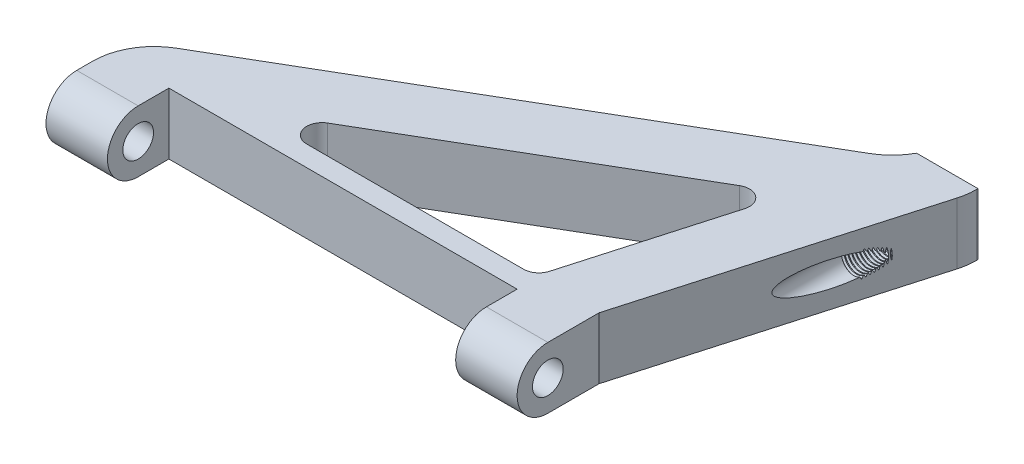
from build123d import *
from build123d.topology import SkipClean

# Parameters (mm, degrees)
BOSS_EXTRUDE1_DEPTH = 19.05
CUT_EXTRUDE1_REACH  = 202.955
SKETCH3_R           = 3.96875
FILLET1_RADIUS      = 9.525
FILLET1_LENGTH      = 19.05
SKETCH6_R           = 4.7625
CUT_EXTRUDE3_DEPTH  = 189.398196979
FILLET2_RADIUS      = 9.525
FILLET2_LENGTH      = 19.05
FILLET3_R           = 19.05
FILLET6_R           = 19.05
THREAD2_PITCH       = 1.058333333


with BuildPart() as part:
    # Sketch1 → Boss-Extrude1 (new body)
    with BuildSketch(Plane(origin=(0, 0, 0), x_dir=(1, 0, 0), z_dir=(0, 1, 0))):
        Polygon((142.875, 0), (161.925, 0), (161.925, -3.175), (136.525, -92.075), (136.525, -117.475), (117.475, -117.475), (117.475, -98.425), (9.525, -98.425), (9.525, -117.475), (-9.525, -117.475), (-9.525, -92.075), (142.875, -3.175), align=None)
        with BuildLine():
            Line((131.143985717, -41.565503295), (117.699598267, -88.620859372))
            ThreePointArc((117.699598267, -88.620859372), (115.988296597, -91.114635437), (113.120340466, -92.075))
            Line((113.120340466, -92.075), (45.898403214, -92.075))
            ThreePointArc((45.898403214, -92.075), (41.300951398, -88.555417151), (43.498717455, -83.198752984))
            Line((43.498717455, -83.198752984), (124.165042157, -36.143396908))
            ThreePointArc((124.165042157, -36.143396908), (129.486618227, -36.496297841), (131.143985717, -41.565503295))
        make_face(mode=Mode.SUBTRACT)
    extrude(amount=BOSS_EXTRUDE1_DEPTH)

    # Cut-Extrude1: up to this plane
    cut_extrude1_end = Plane(origin=(150.542924528, 19.05, 43.012264151), z_dir=(-0.9615239476408233, 0, -0.27472112789737785))
    # Sketch3 → Cut-Extrude1 (cut, up to the surface)
    with BuildSketch(Plane(origin=(0, 0, 0), x_dir=(-1, 0, 0), z_dir=(0, 0, -1)), mode=Mode.PRIVATE) as cut_extrude1_sk1:
        with Locations((-152.4, 9.525)):
            Circle(SKETCH3_R)
    cut_extrude1_tool1 = split(extrude(cut_extrude1_sk1.sketch, amount=-CUT_EXTRUDE1_REACH, mode=Mode.PRIVATE), bisect_by=cut_extrude1_end, keep=Keep.BOTH, mode=Mode.PRIVATE)
    add(cut_extrude1_tool1.solids().sort_by_distance((152.4, 9.525, 0))[0], mode=Mode.SUBTRACT)

    # Fillet1: full round fillet: the end face becomes a half cylinder, R = half its width
    fillet1_face = Plane((0, 9.525, 117.475), x_dir=(-1, 0, 0), z_dir=(0, 0, 1))  # on the end face: x along it, z out of the body
    fillet1_slab = fillet1_face.offset(-FILLET1_RADIUS / 2) * Box(FILLET1_LENGTH, 2 * FILLET1_RADIUS, FILLET1_RADIUS, mode=Mode.PRIVATE)  # the body's end, R deep
    fillet1_round = Plane((0, 9.525, 107.95), x_dir=(0, 0, 1), z_dir=(-1, 0, 0)) * Cylinder(FILLET1_RADIUS, FILLET1_LENGTH, mode=Mode.PRIVATE)  # its axis R under the face
    add(fillet1_slab - fillet1_round, mode=Mode.SUBTRACT)

    # Sketch6 → Cut-Extrude3 (cut, through all)
    with BuildSketch(Plane(origin=(136.525, 0, 0), x_dir=(0, 0, -1), z_dir=(1, 0, 0))):
        with Locations((-107.95, 9.525)):
            Circle(SKETCH6_R)
    extrude(amount=-CUT_EXTRUDE3_DEPTH, mode=Mode.SUBTRACT)

    # Fillet2: full round fillet: the end face becomes a half cylinder, R = half its width
    fillet2_face = Plane((127, 9.525, 117.475), x_dir=(1, 0, 0), z_dir=(0, 0, 1))  # on the end face: x along it, z out of the body
    fillet2_slab = fillet2_face.offset(-FILLET2_RADIUS / 2) * Box(FILLET2_LENGTH, 2 * FILLET2_RADIUS, FILLET2_RADIUS, mode=Mode.PRIVATE)  # the body's end, R deep
    fillet2_round = Plane((127, 9.525, 107.95), x_dir=(0, 0, 1), z_dir=(1, 0, 0)) * Cylinder(FILLET2_RADIUS, FILLET2_LENGTH, mode=Mode.PRIVATE)  # its axis R under the face
    add(fillet2_slab - fillet2_round, mode=Mode.SUBTRACT)

    # Fillet3
    # the kernel refuses this fillet: 19.05 mm, written as the material it adds along each edge
    with BuildSketch(Plane(origin=(142.875, 0, 3.175), x_dir=(-0.8637789008984332, 0, 0.5038710255240864), z_dir=(0, 1, 0))) as fillet3_piece_1:
        with BuildLine():
            CenterArc((8.247436457, -19.05), FILLET3_R, 90, 31.125529059)
            Line((-1.599790506, -2.74249801), (0, 0))
            Line((0, 0), (8.247436457, 0))
        make_face()
    extrude(amount=19.05)
    # the kernel refuses this fillet: 19.05 mm, written as the material it takes off along each edge
    with BuildSketch(Plane(origin=(161.925, -6.670116738, 3.175), x_dir=(0, 0, -1), z_dir=(0, 1, 0))) as fillet3_2_piece_1:
        with BuildLine():
            CenterArc((FILLET3_R * 0.14005494464, FILLET3_R), FILLET3_R, 254.054604099, 15.945395901)
            Line((-FILLET3_R * 0.134666183257, FILLET3_R * 0.0384760523592), (0, 0))
            Line((0, 0), (FILLET3_R * 0.14005494464, 0))
        make_face()
    extrude(amount=32.390233477, mode=Mode.SUBTRACT)

    # Fillet6
    fillet6_edges = [part.edges().sort_by_distance(p)[0] for p in [
        (-9.525, 9.525, 92.075),
    ]]
    fillet(fillet6_edges, radius=FILLET6_R)

    # Thread2: arcs per turn and ends read off the stored shape
    # Thread2: the profile of Thread Profile2 profile screwed along a right-hand helix through 27 turns, 8 arcs to a turn; built about Z, then put on its axis
    with SkipClean():  # the faces are left unmerged after this step: merging them gives an invalid solid
        thread2_z = Axis((0, 0, 0), (0, 0, 1))
        thread2_corners = [(3.96845, 0, -0.000173205), (4.541589718, 0, 0.330729165), (4.541589718, 0, 0.463020832), (3.96845, 0, 0.793923202)]
        with BuildLine(mode=Mode.PRIVATE) as thread2_profile:
            Line(thread2_corners[0], thread2_corners[1])
            Line(thread2_corners[1], thread2_corners[2])
            Line(thread2_corners[2], thread2_corners[3])
            Line(thread2_corners[3], thread2_corners[0])
        thread2_cap = Face(thread2_profile.wire())
        thread2_turn_angles = [0, 22.5, 45, 67.5, 90, 112.5, 135, 157.5, 180, 202.5, 225, 247.5, 270, 292.5, 315, 337.5, 360]
        thread2_turn_weights = [1, 0.9238795325112867, 1, 0.9238795325112867, 1, 0.9238795325112867, 1, 0.9238795325112867, 1, 0.9238795325112867, 1, 0.9238795325112867, 1, 0.9238795325112867, 1, 0.9238795325112867, 1]
        thread2_turn_rails = [Edge.make_bspline([Vector(p[0], p[1], 0).rotate(thread2_z, thread2_turn_angles[k]) / thread2_turn_weights[k] + Vector(0, 0, p[2] + THREAD2_PITCH * thread2_turn_angles[k] / 360) for k in range(17)], [0, 0, 0, 1, 1, 2, 2, 3, 3, 4, 4, 5, 5, 6, 6, 7, 7, 8, 8, 8], 2, thread2_turn_weights) for p in thread2_corners]
        thread2_turn_sides = [Face.make_surface_from_curves(thread2_turn_rails[p[0]], thread2_turn_rails[p[1]]) for p in [(0, 1), (1, 2), (2, 3), (3, 0)]]
        thread2 = Plane(origin=(152.4, 9.525, 0), x_dir=(1, 0, 0), z_dir=(0, 0, 1)) * Solid(Shell([*[p.moved(Location((0, 0, THREAD2_PITCH * i))) for i in range(27) for p in thread2_turn_sides], thread2_cap, thread2_cap.rotate(thread2_z, 9720).moved(Location((0, 0, THREAD2_PITCH * 9720 / 360)))]))
        add(thread2, mode=Mode.SUBTRACT)


solid = part.part
